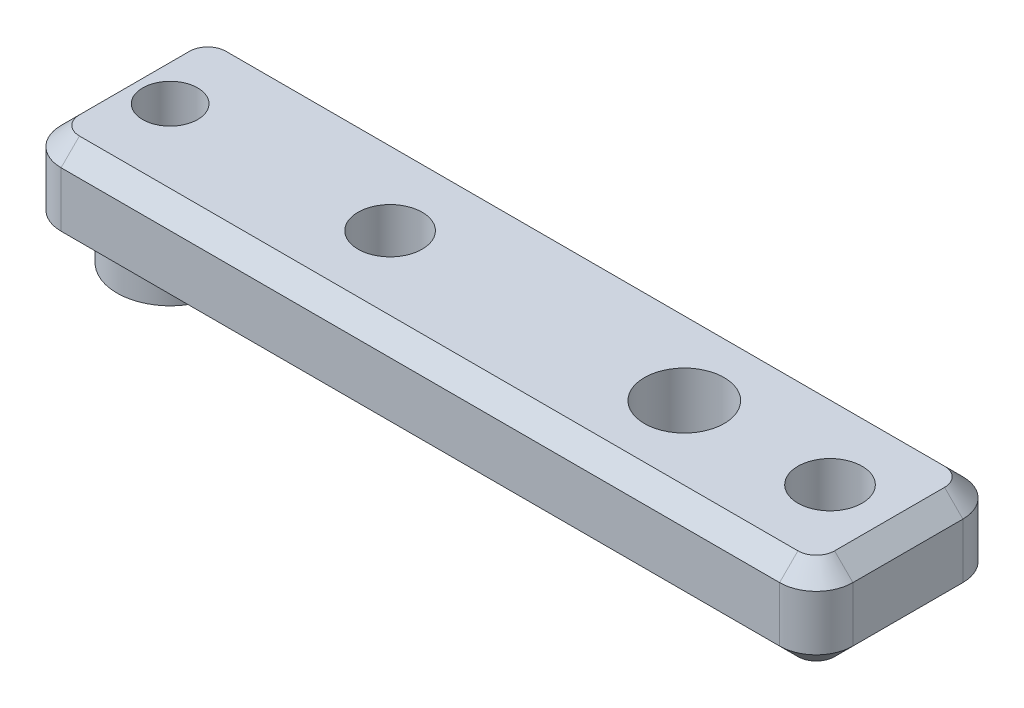
from build123d import *

# Parameters (mm, degrees)
SKETCH1_W           = 54
SKETCH1_H           = 10
BOSS_EXTRUDE1_DEPTH = 5
SKETCH3_R           = 1.5
SKETCH3_R_2         = 2.175
SKETCH3_R_3         = 1.75
CUT_EXTRUDE1_DEPTH  = 7
FILLET1_R           = 2
SKETCH4_R           = 2.9
SKETCH4_R_2         = 1.5
BOSS_EXTRUDE2_DEPTH = 2.5
SKETCH5_W           = 14.628032649
SKETCH5_H           = 11.072623212
CUT_EXTRUDE2_DEPTH  = 10
FILLET2_R           = 2
CHAMFER1_SIZE       = 1


with BuildPart() as part:
    # Sketch1 → Boss-Extrude1 (new body)
    with BuildSketch(Plane(origin=(0, 0, 0), x_dir=(1, 0, 0), z_dir=(0, 1, 0))):
        Rectangle(SKETCH1_W, SKETCH1_H)
    extrude(amount=BOSS_EXTRUDE1_DEPTH)

    # Sketch3 → Cut-Extrude1 (cut)
    with BuildSketch(Plane(origin=(0, 5, 0), x_dir=(1, 0, 0), z_dir=(0, 1, 0))):
        with Locations(Location((-24.05, 0, 0), (0, 0, 270))):
            Circle(SKETCH3_R)
        with Locations(Location((4, 0, 0), (0, 0, 270))):
            Circle(SKETCH3_R_2)
        with Locations(Location((-12.05, 0, 0), (0, 0, 270))):
            Circle(SKETCH3_R_3)
        with Locations(Location((11.95, 0, 0), (0, 0, 270))):
            Circle(SKETCH3_R_3)
    extrude(amount=-CUT_EXTRUDE1_DEPTH, mode=Mode.SUBTRACT)

    # Fillet1
    fillet1_edges = [part.edges().sort_by_distance(p)[0] for p in [
        (27, 2.5, 5),
        (-27, 2.5, 5),
        (-27, 2.5, -5),
        (27, 2.5, -5),
    ]]
    fillet(fillet1_edges, radius=FILLET1_R)

    # Sketch4 → Boss-Extrude2 (add)
    with BuildSketch(Plane.XZ):
        with Locations(Location((-24.05, 0, 0), (0, 0, 270))):
            Circle(SKETCH4_R)
        with Locations(Location((-24.05, 0, 0), (0, 0, 90))):
            Circle(SKETCH4_R_2, mode=Mode.SUBTRACT)
    extrude(amount=BOSS_EXTRUDE2_DEPTH)

    # Sketch5 → Cut-Extrude2 (cut)
    with BuildSketch(Plane(origin=(0, 5, 0), x_dir=(1, 0, 0), z_dir=(0, 1, 0))):
        with Locations((23.514016324, -0.536311606)):
            Rectangle(SKETCH5_W, SKETCH5_H)
    extrude(amount=-CUT_EXTRUDE2_DEPTH, mode=Mode.SUBTRACT)

    # Fillet2
    fillet2_edges = [part.edges().sort_by_distance(p)[0] for p in [
        (16.2, 2.5, 5),
        (16.2, 2.5, -5),
    ]]
    fillet(fillet2_edges, radius=FILLET2_R)

    # Chamfer1
    # the kernel refuses this chamfer: 1 mm, written as the material it takes off along each edge
    with BuildSketch(Plane(origin=(14.2, 0, -3), x_dir=(0, 0, -1), z_dir=(-1, 0, 0))) as chamfer1_piece_1:
        Polygon((2 - CHAMFER1_SIZE, 0), (2, -CHAMFER1_SIZE), (2, 0), align=None)
    revolve(axis=Axis((14.2, 0, -3), (0, -1, 0)), revolution_arc=90, mode=Mode.SUBTRACT)
    with BuildSketch(Plane(origin=(14.2, 0, 5), x_dir=(0, -0.027495876610586365, -0.9996219169112968), z_dir=(-1, 0, 0)), Plane(origin=(-25, 5, -5), x_dir=(0, -0.9996219169112968, -0.027495876610586487), z_dir=(1, 0, 0))) as chamfer1_piece_2:
        Polygon((CHAMFER1_SIZE * 0.999621916911, -CHAMFER1_SIZE * 0.0274958766106), (-CHAMFER1_SIZE * 0.0274958766106, -CHAMFER1_SIZE * 0.999621916911), (0, 0), align=None)
    extrude(amount=39.2, mode=Mode.SUBTRACT)
    with BuildSketch(Plane(origin=(-27, 0, 3), x_dir=(0.9996219169112968, -0.02749587661058639, 0), z_dir=(0, 0, -1))) as chamfer1_piece_3_section:
        Polygon((CHAMFER1_SIZE * 0.999621916911, -CHAMFER1_SIZE * 0.0274958766106), (-CHAMFER1_SIZE * 0.0274958766106, -CHAMFER1_SIZE * 0.999621916911), (0, 0), align=None)
    chamfer1_piece_3 = extrude(amount=6, mode=Mode.PRIVATE)
    chamfer1_piece_3 = chamfer1_piece_3 - Plane(origin=(-24.05, 0.490897833, 0), x_dir=(0, 0, -1), z_dir=(0, 1, 0)) * Cylinder(2.9, 16, mode=Mode.PRIVATE)
    add(chamfer1_piece_3, mode=Mode.SUBTRACT)
    with BuildSketch(Plane(origin=(-25, 0, 3), x_dir=(-1, 0, 0), z_dir=(0, 0, -1))) as chamfer1_piece_4:
        Polygon((2 - CHAMFER1_SIZE, 0), (2, CHAMFER1_SIZE), (2, 0), align=None)
    revolve(axis=Axis((-25, 0, 3), (0, 1, 0)), revolution_arc=90, mode=Mode.SUBTRACT)
    with BuildSketch(Plane(origin=(-25, 0, -3), x_dir=(0, 0, -1), z_dir=(1, 0, 0))) as chamfer1_piece_5:
        Polygon((2 - CHAMFER1_SIZE, 0), (2, CHAMFER1_SIZE), (2, 0), align=None)
    revolve(axis=Axis((-25, 0, -3), (0, 1, 0)), revolution_arc=90, mode=Mode.SUBTRACT)
    with BuildSketch(Plane(origin=(-27, 5, 3), x_dir=(0.9996219169112968, 0.02749587661058651, 0), z_dir=(0, 0, -1))) as chamfer1_piece_6:
        Polygon((CHAMFER1_SIZE * 0.999621916911, CHAMFER1_SIZE * 0.0274958766106), (-CHAMFER1_SIZE * 0.0274958766106, CHAMFER1_SIZE * 0.999621916911), (0, 0), align=None)
    extrude(amount=6, mode=Mode.SUBTRACT)
    with BuildSketch(Plane(origin=(14.2, 5, 5), x_dir=(0, 0.027495876610586487, -0.9996219169112968), z_dir=(-1, 0, 0)), Plane(origin=(-25, 0, -5), x_dir=(0, 0.9996219169112968, -0.027495876610586494), z_dir=(1, 0, 0))) as chamfer1_piece_7:
        Polygon((CHAMFER1_SIZE * 0.999621916911, CHAMFER1_SIZE * 0.0274958766106), (-CHAMFER1_SIZE * 0.0274958766106, CHAMFER1_SIZE * 0.999621916911), (0, 0), align=None)
    extrude(amount=39.2, mode=Mode.SUBTRACT)
    with BuildSketch(Plane(origin=(-25, 5, 3), x_dir=(-1, 0, 0), z_dir=(0, 0, -1))) as chamfer1_piece_8:
        Polygon((2 - CHAMFER1_SIZE, 0), (2, -CHAMFER1_SIZE), (2, 0), align=None)
    revolve(axis=Axis((-25, 5, 3), (0, 1, 0)), revolution_arc=90, mode=Mode.SUBTRACT)
    with BuildSketch(Plane(origin=(-25, 5, -3), x_dir=(0, 0, -1), z_dir=(1, 0, 0))) as chamfer1_piece_9:
        Polygon((2, -CHAMFER1_SIZE), (2 - CHAMFER1_SIZE, 0), (2, 0), align=None)
    revolve(axis=Axis((-25, 5, -3), (0, 1, 0)), revolution_arc=90, mode=Mode.SUBTRACT)
    with BuildSketch(Plane(origin=(16.2, 0, -3), x_dir=(-0.9996219169112968, -0.02749587661058639, 0), z_dir=(0, 0, 1)), Plane(origin=(16.2, 5, 3), x_dir=(-0.9996219169112968, 0.02749587661058651, 0), z_dir=(0, 0, -1))) as chamfer1_piece_10:
        Polygon((CHAMFER1_SIZE * 0.999621916911, -CHAMFER1_SIZE * 0.0274958766106), (-CHAMFER1_SIZE * 0.0274958766106, -CHAMFER1_SIZE * 0.999621916911), (0, 0), align=None)
    extrude(amount=6, mode=Mode.SUBTRACT)
    with BuildSketch(Plane(origin=(14.2, 5, 3), x_dir=(1, 0, 0), z_dir=(0, 0, -1))) as chamfer1_piece_11:
        Polygon((2 - CHAMFER1_SIZE, 0), (2, CHAMFER1_SIZE), (2, 0), align=None)
    revolve(axis=Axis((14.2, 5, 3), (0, -1, 0)), revolution_arc=90, mode=Mode.SUBTRACT)
    with BuildSketch(Plane(origin=(14.2, 5, -3), x_dir=(0, 0, -1), z_dir=(-1, 0, 0))) as chamfer1_piece_12:
        Polygon((2, CHAMFER1_SIZE), (2 - CHAMFER1_SIZE, 0), (2, 0), align=None)
    revolve(axis=Axis((14.2, 5, -3), (0, -1, 0)), revolution_arc=90, mode=Mode.SUBTRACT)
    with BuildSketch(Plane(origin=(14.2, 0, 3), x_dir=(1, 0, 0), z_dir=(0, 0, -1))) as chamfer1_piece_13:
        Polygon((2 - CHAMFER1_SIZE, 0), (2, -CHAMFER1_SIZE), (2, 0), align=None)
    revolve(axis=Axis((14.2, 0, 3), (0, -1, 0)), revolution_arc=90, mode=Mode.SUBTRACT)


solid = part.part
